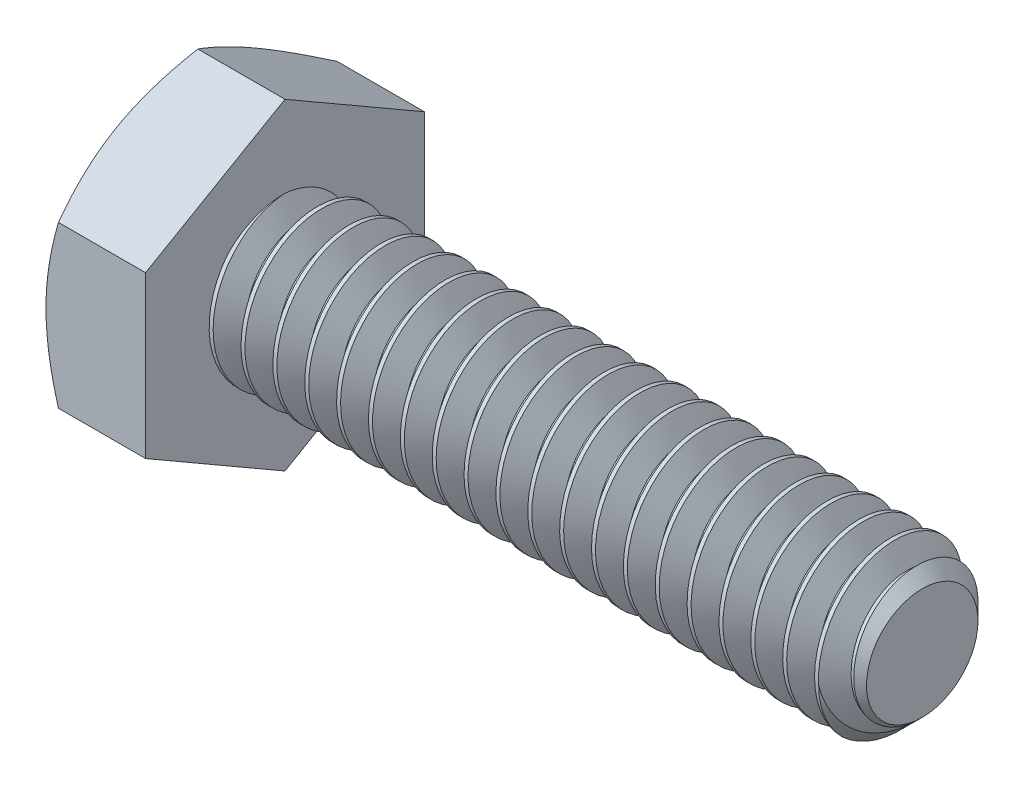
from build123d import *

# Parameters (mm, degrees)
SKETCH5_R           = 3.175
BOSS_EXTRUDE3_DEPTH = 25.4
CHAMFER1_SIZE       = 0.9525
CUT_SWEEP1_PITCH    = 1.27
BOSS_EXTRUDE4_DEPTH = 3.96875
SKETCH8_OUTSIDE_W   = 129.26
SKETCH8_OUTSIDE_H   = 130.98
SKETCH8_OUTSIDE_R   = 5.55625
CUT_EXTRUDE3_DEPTH  = 31.570540574
CUT_EXTRUDE3_DRAFT  = -60


with BuildPart() as part:
    # Sketch5 → Boss-Extrude3 (new body)
    with BuildSketch(Plane(origin=(14.684375, 0, 0), x_dir=(0, 0, -1), z_dir=(1, 0, 0))):
        Circle(SKETCH5_R)
    extrude(amount=-BOSS_EXTRUDE3_DEPTH)

    # Chamfer1
    chamfer1_edges = [part.edges().sort_by_distance(p)[0] for p in [
        (14.684375, 0, 3.175),
    ]]
    chamfer(chamfer1_edges, length=CHAMFER1_SIZE)

    # Cut-Sweep1: the profile of Sketch10 profile screwed along a right-hand helix of 21 turns, 8 arcs to a turn; built about Z, then put on its axis
    cut_sweep1_z = Axis((0, 0, 0), (0, 0, 1))
    cut_sweep1_corners = [(3.1753, 0, 0.000173205), (2.350110803, 0, -0.47625), (2.350110803, 0, -0.635), (3.1753, 0, -1.111423205)]
    with BuildLine(mode=Mode.PRIVATE) as cut_sweep1_profile:
        Line(cut_sweep1_corners[0], cut_sweep1_corners[1])
        Line(cut_sweep1_corners[1], cut_sweep1_corners[2])
        Line(cut_sweep1_corners[2], cut_sweep1_corners[3])
        Line(cut_sweep1_corners[3], cut_sweep1_corners[0])
    cut_sweep1_cap = Face(cut_sweep1_profile.wire())
    cut_sweep1_turn_angles = [0, 22.5, 45, 67.5, 90, 112.5, 135, 157.5, 180, 202.5, 225, 247.5, 270, 292.5, 315, 337.5, 360]
    cut_sweep1_turn_weights = [1, 0.9238795325112867, 1, 0.9238795325112867, 1, 0.9238795325112867, 1, 0.9238795325112867, 1, 0.9238795325112867, 1, 0.9238795325112867, 1, 0.9238795325112867, 1, 0.9238795325112867, 1]
    cut_sweep1_turn_rails = [Edge.make_bspline([Vector(p[0], p[1], 0).rotate(cut_sweep1_z, cut_sweep1_turn_angles[k]) / cut_sweep1_turn_weights[k] + Vector(0, 0, p[2] + CUT_SWEEP1_PITCH * cut_sweep1_turn_angles[k] / 360) for k in range(17)], [0, 0, 0, 1, 1, 2, 2, 3, 3, 4, 4, 5, 5, 6, 6, 7, 7, 8, 8, 8], 2, cut_sweep1_turn_weights) for p in cut_sweep1_corners]
    cut_sweep1_turn_sides = [Face.make_surface_from_curves(cut_sweep1_turn_rails[p[0]], cut_sweep1_turn_rails[p[1]]) for p in [(0, 1), (1, 2), (2, 3), (3, 0)]]
    cut_sweep1 = Plane(origin=(14.684375, 0, 0), x_dir=(0, 1, 0), z_dir=(-1, 0, 0)) * Solid(Shell([*[p.moved(Location((0, 0, CUT_SWEEP1_PITCH * i))) for i in range(21) for p in cut_sweep1_turn_sides], cut_sweep1_cap, cut_sweep1_cap.rotate(cut_sweep1_z, 7560).moved(Location((0, 0, CUT_SWEEP1_PITCH * 7560 / 360)))]))
    add(cut_sweep1, mode=Mode.SUBTRACT)

    # Sketch6 → Boss-Extrude4 (add)
    with BuildSketch(Plane.ZY.offset(10.715625)):
        Polygon((5.55625, 3.207902433), (0, 6.415804866), (-5.55625, 3.207902433), (-5.55625, -3.207902433), (0, -6.415804866), (5.55625, -3.207902433), align=None)
    extrude(amount=BOSS_EXTRUDE4_DEPTH)


with BuildPart() as cut_extrude3_tool:
    # Sketch8 outside → Cut-Extrude3 (with draft: the straight prism first)
    with BuildSketch(Plane.ZY.offset(14.684375)):
        Rectangle(SKETCH8_OUTSIDE_W, SKETCH8_OUTSIDE_H)
        Circle(SKETCH8_OUTSIDE_R, mode=Mode.SUBTRACT)
    extrude(amount=-CUT_EXTRUDE3_DEPTH)
    # Cut-Extrude3: the draft: its side faces are tilted about the plane it starts from
    cut_extrude3_sides = [cut_extrude3_tool.faces().sort_by_distance(p)[0] for p in [
        (1.100895287, -65.49, 0),
        (1.100895287, 0, 64.63),
        (1.100895287, 65.49, 0),
        (1.100895287, 0, -64.63),
        (1.100895287, 0, -5.55625),
    ]]
    draft(cut_extrude3_sides, Plane.ZY.offset(14.684375), CUT_EXTRUDE3_DRAFT)


with BuildPart() as part_1:
    add(part.part)

    # Cut-Extrude3: cut by cut_extrude3_tool
    add(cut_extrude3_tool.part, mode=Mode.SUBTRACT)


solid = part_1.part
